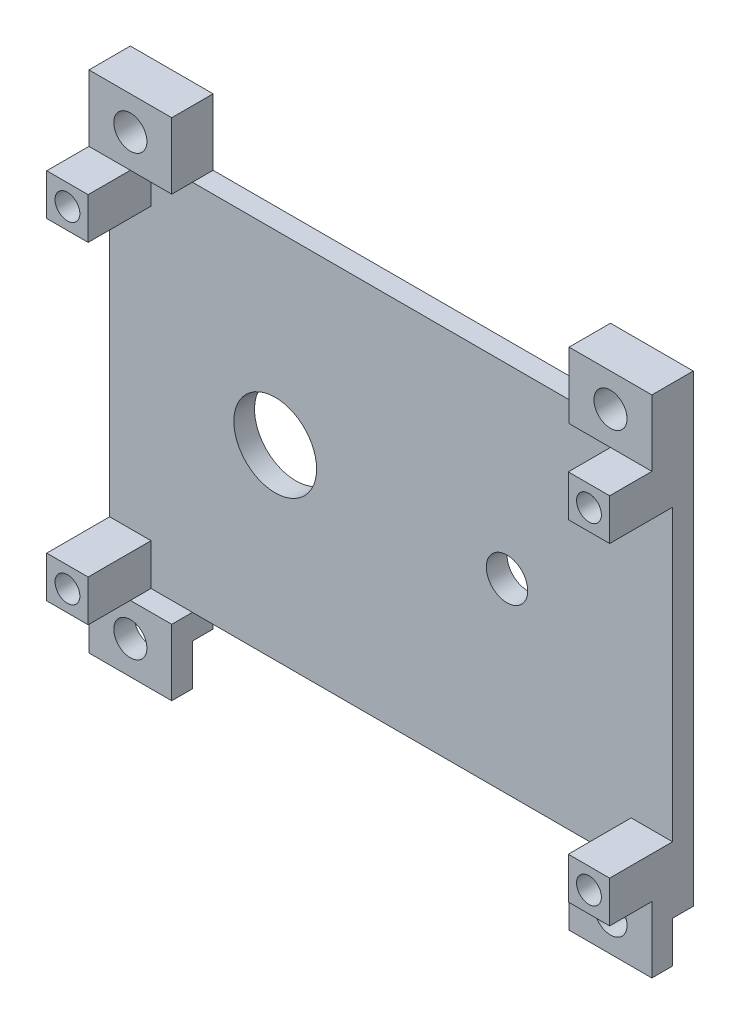
from build123d import *

# Parameters (mm, degrees)
SKICA1_W                     = 68
SKICA1_H                     = 45
SKICA1_R                     = 5
SKICA1_R_2                   = 2.5
P_IDAT_VYSUNUT_M1_DEPTH      = 2.5
SKICA2_W                     = 5
SKICA2_H                     = 5
P_IDAT_VYSUNUT_M2_DEPTH      = 7.6
SKICA3_R                     = 1.5
ODEBRAT_VYSUNUT_M1_DEPTH     = 10.1
SKICA8_R                     = 1.5
ODEBRAT_VYSUNUT_M2_DEPTH     = 10.1
SKICA9_R                     = 1.5
ODEBRAT_VYSUNUT_M3_DEPTH     = 10.1
SKICA10_R                    = 1.5
ODEBRAT_VYSUNUT_M4_DEPTH     = 10.1
P_IDAT_VYSUNUT_M3_DEPTH      = 8
P_IDAT_VYSUNUT_M3_DEPTH_BACK = 48
SKICA11_W                    = 10
SKICA11_H                    = 2.5
SKICA12_R                    = 2
ODEBRAT_VYSUNUT_M5_DEPTH     = 8
P_IDAT_START                 = 2.5
SKICA13_W                    = 10
SKICA13_H                    = 8
SKICA13_R                    = 2
P_IDAT_VYSUNUT_M4_DEPTH      = 2.5


with BuildPart() as part:
    # Skica1 → Přidat vysunutím1 (new body)
    with BuildSketch(Plane.XY):
        Rectangle(SKICA1_W, SKICA1_H)
        with Locations((-14, 0)):
            Circle(SKICA1_R, mode=Mode.SUBTRACT)
        with Locations((14, 0)):
            Circle(SKICA1_R_2, mode=Mode.SUBTRACT)
    extrude(amount=P_IDAT_VYSUNUT_M1_DEPTH)

    # Skica2 → Přidat vysunutím2 (add)
    with BuildSketch(Plane.XY.offset(2.5)):
        with Locations((-31.5, 20)):
            Rectangle(SKICA2_W, SKICA2_H)
        with Locations((31.5, 20)):
            Rectangle(SKICA2_W, SKICA2_H)
        with Locations((31.5, -20)):
            Rectangle(SKICA2_W, SKICA2_H)
        with Locations((-31.5, -20)):
            Rectangle(SKICA2_W, SKICA2_H)
    extrude(amount=P_IDAT_VYSUNUT_M2_DEPTH)

    # Skica3 → Odebrat vysunutím1 (cut)
    with BuildSketch(Plane.XY.offset(10.1)):
        with Locations((-31.5, 20)):
            Circle(SKICA3_R)
    extrude(amount=-ODEBRAT_VYSUNUT_M1_DEPTH, mode=Mode.SUBTRACT)

    # Skica8 → Odebrat vysunutím2 (cut)
    with BuildSketch(Plane.XY.offset(10.1)):
        with Locations((31.5, 20)):
            Circle(SKICA8_R)
    extrude(amount=-ODEBRAT_VYSUNUT_M2_DEPTH, mode=Mode.SUBTRACT)

    # Skica9 → Odebrat vysunutím3 (cut)
    with BuildSketch(Plane.XY.offset(10.1)):
        with Locations((31.5, -20)):
            Circle(SKICA9_R)
    extrude(amount=-ODEBRAT_VYSUNUT_M3_DEPTH, mode=Mode.SUBTRACT)

    # Skica10 → Odebrat vysunutím4 (cut)
    with BuildSketch(Plane.XY.offset(10.1)):
        with Locations((-31.5, -20)):
            Circle(SKICA10_R)
    extrude(amount=-ODEBRAT_VYSUNUT_M4_DEPTH, mode=Mode.SUBTRACT)

    # Skica11 → Přidat vysunutím3 (add, two sides: drawn at the far end of the back side and taken through both)
    with BuildSketch(Plane(origin=(0, 22.5, 0), x_dir=(1, 0, 0), z_dir=(0, 1, 0)).offset(-P_IDAT_VYSUNUT_M3_DEPTH_BACK)):
        with Locations((-29, -1.25)):
            Rectangle(SKICA11_W, SKICA11_H)
        with Locations((29, -1.25)):
            Rectangle(SKICA11_W, SKICA11_H)
    extrude(amount=P_IDAT_VYSUNUT_M3_DEPTH + P_IDAT_VYSUNUT_M3_DEPTH_BACK)

    # Skica12 → Odebrat vysunutím5 (cut)
    with BuildSketch(Plane.XY.offset(2.5)):
        with Locations((-29, 26.5)):
            Circle(SKICA12_R)
        with Locations((29, 26.5)):
            Circle(SKICA12_R)
        with Locations((29, -26.5)):
            Circle(SKICA12_R)
        with Locations((-29, -26.5)):
            Circle(SKICA12_R)
    extrude(amount=-ODEBRAT_VYSUNUT_M5_DEPTH, mode=Mode.SUBTRACT)

    # Skica13 → Přidat vysunutím4 (add)
    # profile 1 of 4: a face of its own
    with BuildSketch(Plane.XY.offset(2.5).offset(P_IDAT_START)):
        with Locations((-29, 26.5)):
            Rectangle(SKICA13_W, SKICA13_H)
        with Locations((-29, 26.5)):
            Circle(SKICA13_R, mode=Mode.SUBTRACT)
    # profile 2 of 4: a face of its own
    with BuildSketch(Plane.XY.offset(2.5).offset(P_IDAT_START)):
        with Locations((29, 26.5)):
            Rectangle(SKICA13_W, SKICA13_H)
        with Locations((29, 26.5)):
            Circle(SKICA13_R, mode=Mode.SUBTRACT)
    # profile 3 of 4: a face of its own
    with BuildSketch(Plane.XY.offset(2.5).offset(P_IDAT_START)):
        with Locations((29, -26.5)):
            Rectangle(SKICA13_W, SKICA13_H)
        with Locations((29, -26.5)):
            Circle(SKICA13_R, mode=Mode.SUBTRACT)
    # profile 4 of 4: a face of its own
    with BuildSketch(Plane.XY.offset(2.5).offset(P_IDAT_START)):
        with Locations((-29, -26.5)):
            Rectangle(SKICA13_W, SKICA13_H)
        with Locations((-29, -26.5)):
            Circle(SKICA13_R, mode=Mode.SUBTRACT)
    extrude(amount=-P_IDAT_VYSUNUT_M4_DEPTH)


solid = part.part
